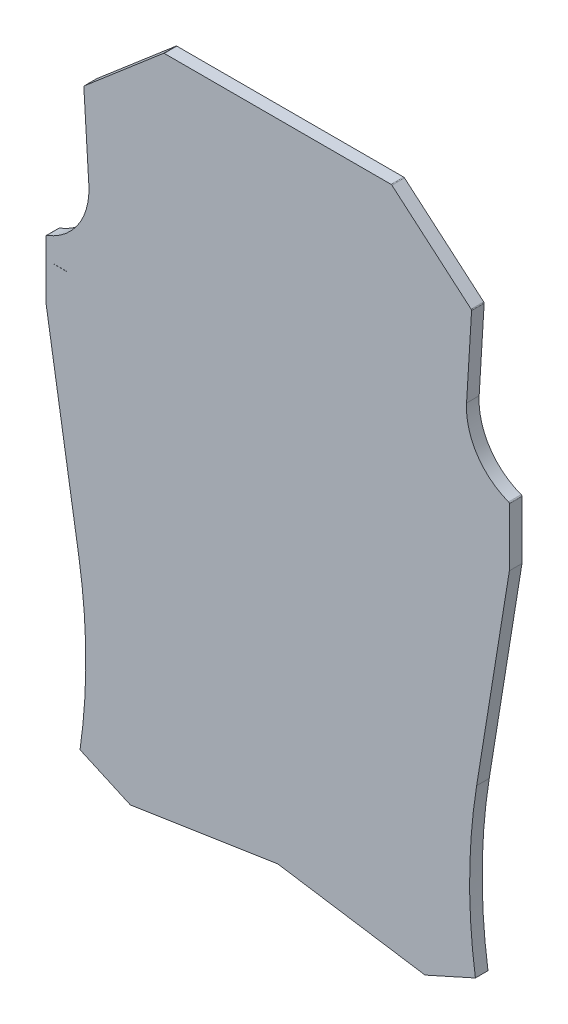
from build123d import *

# Parameters (mm, degrees)
EXTRUDE_1_DEPTH   = 5
EXTRUDE_1_2_DEPTH = 5


# Read off the part's stored shape, not the designer's step: 拉伸-薄壁1
with BuildPart() as part:
    # Extrude 1 outline → Extrude 1 (new body)
    with BuildSketch(Plane.XY):
        with BuildLine():
            ThreePointArc((-91.999999998, -43.29999887), (-91.998341789, -43.340687344), (-91.993377975, -43.381105931))
            Line((-91.993377975, -43.381105931), (-81.999999998, -43.29999887))
            Line((-81.999999998, -43.29999887), (-81.999999998, -41.231306411))
            ThreePointArc((-81.999999998, -41.231306411), (-68.990237418, -27.264516088), (-65.018315032, -8.595049387))
            Line((-65.018315032, -8.595049387), (-66.717183167, 19.436274835))
            Line((-66.717183167, 19.436274835), (-41.506651541, 41))
            Line((-41.506651541, 41), (41.506651544, 41))
            Line((41.506651544, 41), (66.717183171, 19.436274835))
            Line((66.717183171, 19.436274835), (65.018315035, -8.595049396))
            ThreePointArc((65.018315035, -8.595049396), (68.990237423, -27.264516092), (82.000000002, -41.231306411))
            Line((82.000000002, -41.231306411), (82.000000002, -57.596758434))
            Line((82.000000002, -57.596758434), (69.128212183, -137.203815401))
            ThreePointArc((69.128212183, -137.203815401), (66.269370107, -168.113208397), (67.632339208, -199.124591285))
            Line((67.632339208, -199.124591285), (57.095329321, -203.866245712))
            Line((57.095329321, -203.866245712), (2e-09, -195.082348893))
            Line((2e-09, -195.082348893), (-57.095329308, -203.86624571))
            Line((-57.095329308, -203.86624571), (-67.632339202, -199.124591258))
            ThreePointArc((-67.632339202, -199.124591258), (-66.269370105, -168.113208363), (-69.128212188, -137.20381536))
            Line((-69.128212188, -137.20381536), (-81.999822911, -57.597853653))
            Line((-81.999822911, -57.597853653), (-81.996689231, -43.383854869))
            Line((-81.996689231, -43.383854869), (-91.996688988, -43.381650225))
            Line((-91.996688988, -43.381650225), (-91.999999999, -58.4))
            Line((-91.999999999, -58.4), (-79.000000006, -138.79999996))
            ThreePointArc((-79.000000006, -138.79999996), (-76.209004677, -171.980865978), (-78.499999999, -205.199999999))
            Line((-78.499999999, -205.199999999), (-58.499999998, -214.2))
            Line((-58.499999998, -214.2), (2e-09, -205.199999999))
            Line((2e-09, -205.199999999), (58.500000002, -214.2))
            Line((58.500000002, -214.2), (78.500000007, -205.200000039))
            ThreePointArc((78.500000007, -205.200000039), (76.209004679, -171.980866018), (79.000000002, -138.799999999))
            Line((79.000000002, -138.799999999), (92.000000002, -58.4))
            Line((92.000000002, -58.4), (92.000000002, -35.349095722))
            ThreePointArc((92.000000002, -35.349095722), (91.910917667, -35.064233027), (91.675413177, -34.880875309))
            ThreePointArc((91.675413177, -34.880875309), (79.107890632, -24.786992353), (75.000000002, -9.2))
            Line((75.000000002, -9.2), (76.984943405, 23.551566159))
            ThreePointArc((76.984943405, 23.551566159), (76.946128848, 23.777138637), (76.810861071, 23.961779211))
            Line((76.810861071, 23.961779211), (45.340334501, 50.87996546))
            ThreePointArc((45.340334501, 50.87996546), (45.188562585, 50.969032371), (45.015332579, 51))
            Line((45.015332579, 51), (-45.015332561, 51))
            ThreePointArc((-45.015332561, 51), (-45.188562568, 50.969032376), (-45.340334486, 50.879965469))
            Line((-45.340334486, 50.879965469), (-76.810861028, 23.961779245))
            ThreePointArc((-76.810861028, 23.961779245), (-76.946128824, 23.777138686), (-76.984943405, 23.551566212))
            Line((-76.984943405, 23.551566212), (-74.999999999, -9.199999994))
            ThreePointArc((-74.999999999, -9.199999994), (-79.107890627, -24.786992351), (-91.675413174, -34.880875309))
            ThreePointArc((-91.675413174, -34.880875309), (-91.910917622, -35.064232967), (-91.999999998, -35.349095576))
            Line((-91.999999998, -35.349095576), (-91.999999998, -43.29999887))
        make_face()
    extrude(amount=EXTRUDE_1_DEPTH)

    # 草图7 → Extrude 1 2 (add)
    with BuildSketch(Plane.XY):
        with BuildLine():
            Line((-81.999999998, -43.29999887), (-83.629600195, -43.313224837))
            Line((-83.629600195, -43.313224837), (-83.629600195, -43.38349487))
            Line((-83.629600195, -43.38349487), (-81.996689231, -43.383854869))
            Line((-81.996689231, -43.383854869), (-81.999822911, -57.597853653))
            Line((-81.999822911, -57.597853653), (-69.128212188, -137.20381536))
            ThreePointArc((-69.128212188, -137.20381536), (-69.063707743, -137.605017492), (-68.999917919, -138.006333867))
            Line((-68.999917919, -138.006333867), (-68.990237418, -138.006333867))
            Line((-68.990237418, -138.006333867), (-68.990237418, -138.06764197))
            ThreePointArc((-68.990237418, -138.06764197), (-66.259225934, -168.550479027), (-67.632339202, -199.124591258))
            Line((-67.632339202, -199.124591258), (-57.095329308, -203.86624571))
            Line((-57.095329308, -203.86624571), (2e-09, -195.082348893))
            Line((2e-09, -195.082348893), (57.095329321, -203.866245712))
            Line((57.095329321, -203.866245712), (67.632339208, -199.124591285))
            ThreePointArc((67.632339208, -199.124591285), (66.269370107, -168.113208397), (69.128212183, -137.203815401))
            Line((69.128212183, -137.203815401), (82.000000002, -57.596758434))
            Line((82.000000002, -57.596758434), (82.000000002, -41.231306411))
            ThreePointArc((82.000000002, -41.231306411), (68.990237423, -27.264516092), (65.018315035, -8.595049396))
            Line((65.018315035, -8.595049396), (66.717183171, 19.436274835))
            Line((66.717183171, 19.436274835), (41.506651544, 41))
            Line((41.506651544, 41), (-41.506651541, 41))
            Line((-41.506651541, 41), (-66.717183167, 19.436274835))
            Line((-66.717183167, 19.436274835), (-65.018315032, -8.595049387))
            ThreePointArc((-65.018315032, -8.595049387), (-68.990237418, -27.264516088), (-81.999999998, -41.231306411))
            Line((-81.999999998, -41.231306411), (-81.999999998, -43.29999887))
        make_face()
    extrude(amount=EXTRUDE_1_2_DEPTH)


solid = part.part
